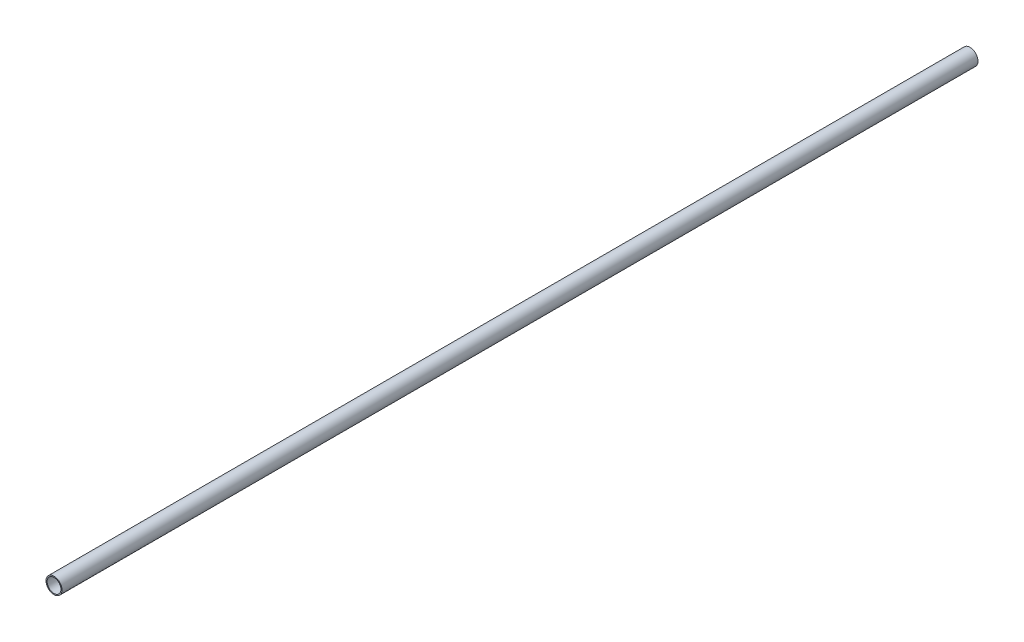
from build123d import *

# Parameters (mm, degrees)
SKETCH1_R           = 3.675
SKETCH1_R_2         = 3.175
BOSS_EXTRUDE1_DEPTH = 420


with BuildPart() as part:
    # Sketch1 → Boss-Extrude1 (new body)
    with BuildSketch(Plane.XY):
        Circle(SKETCH1_R)
        Circle(SKETCH1_R_2, mode=Mode.SUBTRACT)
    extrude(amount=BOSS_EXTRUDE1_DEPTH)


solid = part.part
